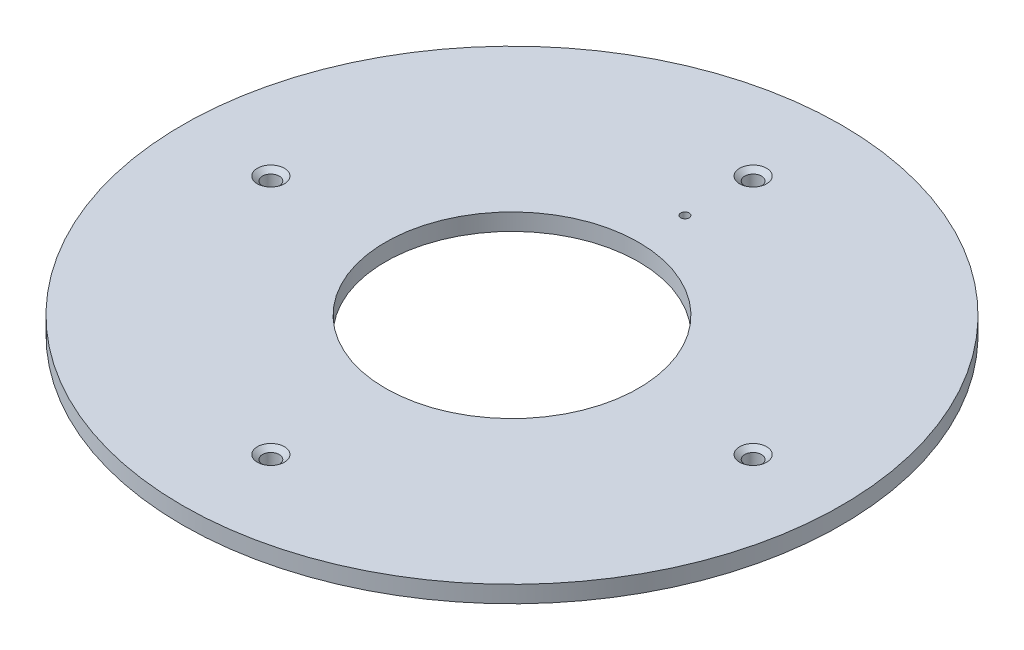
from build123d import *

# Parameters (mm, degrees)
SKETCH1_R                                       = 19.53
BOSS_EXTRUDE1_DEPTH                             = 1
CUT_EXTRUDE1_DEPTH                              = 28.637688036
CUT_EXTRUDE1_DEPTH_BACK                         = 28.637688036
SKETCH2_R                                       = 7.5
CUT_EXTRUDE2_DEPTH                              = 28.637688036
CUT_EXTRUDE2_DEPTH_BACK                         = 28.637688036
SKETCH4_R                                       = 0.25
CSK_FOR_M2_FLAT_HEAD_MACHINE_SCREW1_D           = 1
CSK_FOR_M2_FLAT_HEAD_MACHINE_SCREW1_CSINK_D     = 1.6
CSK_FOR_M2_FLAT_HEAD_MACHINE_SCREW1_CSINK_ANGLE = 100


with BuildPart() as part:
    # Sketch1 → Boss-Extrude1 (new body)
    with BuildSketch(Plane(origin=(0, 0, 0), x_dir=(1, 0, 0), z_dir=(0, 1, 0))):
        Circle(SKETCH1_R)
    extrude(amount=BOSS_EXTRUDE1_DEPTH)

    # Sketch2 → Cut-Extrude1 (cut, two sides: drawn at the far end of the back side and taken through both)
    with BuildSketch(Plane(origin=(0, 1, 0), x_dir=(1, 0, 0), z_dir=(0, 1, 0)).offset(-CUT_EXTRUDE1_DEPTH_BACK)):
        Circle(SKETCH2_R)
    extrude(amount=CUT_EXTRUDE1_DEPTH + CUT_EXTRUDE1_DEPTH_BACK, mode=Mode.SUBTRACT)

    # Sketch4 → Cut-Extrude2 (cut, two sides: drawn at the far end of the back side and taken through both)
    with BuildSketch(Plane(origin=(0, 1, 0), x_dir=(1, 0, 0), z_dir=(0, 1, 0)).offset(-CUT_EXTRUDE2_DEPTH_BACK)):
        with Locations((0, 10.25)):
            Circle(SKETCH4_R)
    extrude(amount=CUT_EXTRUDE2_DEPTH + CUT_EXTRUDE2_DEPTH_BACK, mode=Mode.SUBTRACT)

    # CSK for M2 Flat Head Machine Screw1 (through all)
    with Locations(Plane(origin=(0, 1, 0), x_dir=(1, 0, 0), z_dir=(0, 1, 0))):
        with Locations((0, 14.29), (14.29, 0), (0, -14.29), (-14.29, 0)):
            CounterSinkHole(CSK_FOR_M2_FLAT_HEAD_MACHINE_SCREW1_D / 2, CSK_FOR_M2_FLAT_HEAD_MACHINE_SCREW1_CSINK_D / 2, counter_sink_angle=CSK_FOR_M2_FLAT_HEAD_MACHINE_SCREW1_CSINK_ANGLE)


solid = part.part
